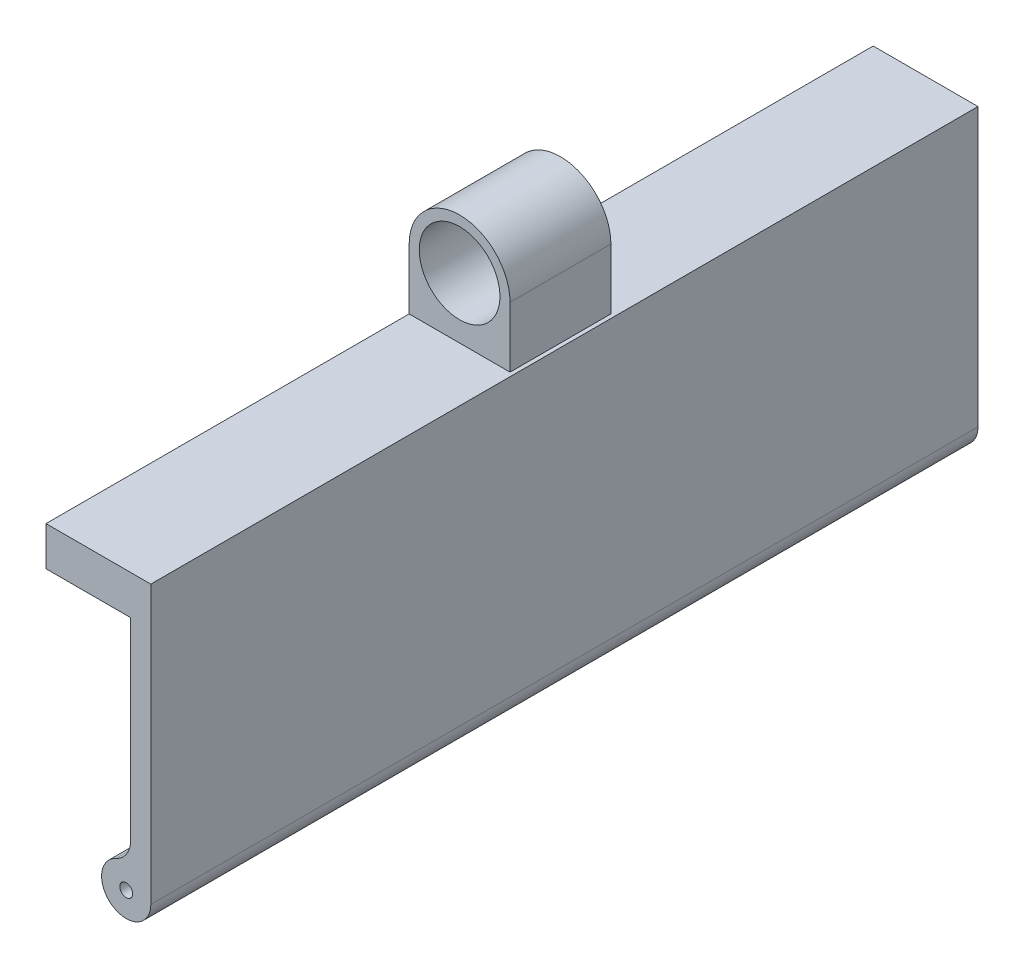
from build123d import *

# Parameters (mm, degrees)
SKETCH1_R           = 0.64
BOSS_EXTRUDE1_DEPTH = 82
SKETCH3_W           = 2
SKETCH3_H           = 82
BOSS_EXTRUDE4_DEPTH = 2.5
SKETCH6_W           = 82
SKETCH6_H           = 3.880734095
BOSS_EXTRUDE5_DEPTH = 8.39
BOSS_EXTRUDE6_START = -36
SKETCH8_R           = 4
BOSS_EXTRUDE6_DEPTH = 10


with BuildPart() as part:
    # Sketch1 → Boss-Extrude1 (new body)
    with BuildSketch(Plane.XY):
        with BuildLine():
            Line((2.44, 0), (2.44, 25))
            Line((2.44, 25), (0.44, 25))
            Line((0.44, 25), (0.44, 4.489988864))
            ThreePointArc((0.44, 4.489988864), (0.044314057, 3.140225052), (-1.017489879, 2.217727293))
            ThreePointArc((-1.017489879, 2.217727293), (-1.317369481, -2.05381052), (2.44, 0))
        make_face()
        Circle(SKETCH1_R, mode=Mode.SUBTRACT)
    extrude(amount=BOSS_EXTRUDE1_DEPTH)

    # Sketch3 → Boss-Extrude4 (add)
    with BuildSketch(Plane(origin=(0, 25, 0), x_dir=(1, 0, 0), z_dir=(0, 1, 0))):
        with Locations((1.44, -41)):
            Rectangle(SKETCH3_W, SKETCH3_H)
    extrude(amount=BOSS_EXTRUDE4_DEPTH)

    # Sketch6 → Boss-Extrude5 (add)
    with BuildSketch(Plane.ZY.offset(-0.44)):
        with Locations((41, 25.559632953)):
            Rectangle(SKETCH6_W, SKETCH6_H)
    extrude(amount=BOSS_EXTRUDE5_DEPTH)

    # Sketch8 → Boss-Extrude6 (add)
    with BuildSketch(Plane(origin=(0, 0, 0), x_dir=(-1, 0, 0), z_dir=(0, 0, -1)).offset(BOSS_EXTRUDE6_START)):
        with BuildLine():
            Line((7.95, 27.5), (7.95, 33.5))
            ThreePointArc((7.95, 33.5), (2.95, 38.5), (-2.05, 33.5))
            Line((-2.05, 33.5), (-2.05, 27.5))
            Line((-2.05, 27.5), (7.95, 27.5))
        make_face()
        with Locations((2.95, 33.5)):
            Circle(SKETCH8_R, mode=Mode.SUBTRACT)
    extrude(amount=-BOSS_EXTRUDE6_DEPTH)


solid = part.part
